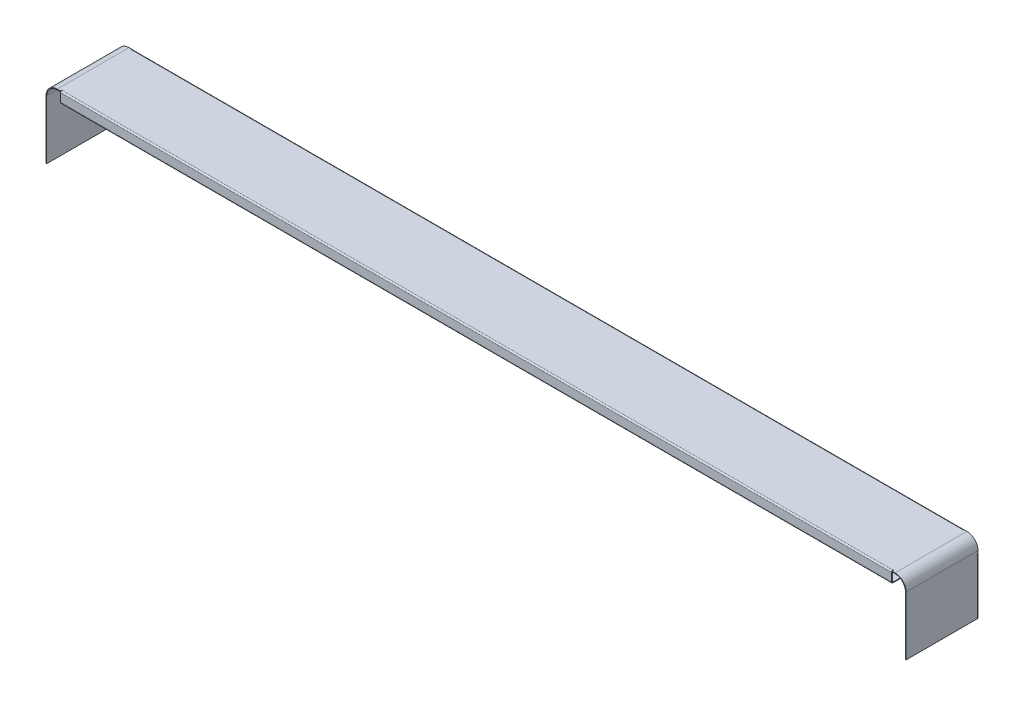
from build123d import *

# Parameters (mm, degrees)
BASE_FLANGE1_DEPTH             = 104
EDGE_FLANGE1_STRIP_W           = 6
EDGE_FLANGE1_STRIP_H           = 1
EDGE_FLANGE1_STRIP_CUT_DEPTH   = 1202
EDGE_FLANGE1_RELIEF_W          = 6.5
EDGE_FLANGE1_RELIEF_H          = 0.5
EDGE_FLANGE1_RELIEF_CUT_DEPTH  = 1
EDGE_FLANGE1_DEPTH             = 1202
EDGE_FLANGE2_STRIP_W           = 6
EDGE_FLANGE2_STRIP_H           = 1
EDGE_FLANGE2_STRIP_CUT_DEPTH   = 1202
EDGE_FLANGE2_DEPTH             = 1202
EDGE_FLANGE3_STRIP_W           = 6
EDGE_FLANGE3_STRIP_H           = 1
EDGE_FLANGE3_STRIP_CUT_DEPTH   = 80
EDGE_FLANGE3_RELIEF_W          = 6.5
EDGE_FLANGE3_RELIEF_H          = 0.5
EDGE_FLANGE3_RELIEF_CUT_DEPTH  = 1
EDGE_FLANGE3_DEPTH             = 80
EDGE_FLANGE4_STRIP_W           = 6
EDGE_FLANGE4_STRIP_H           = 1
EDGE_FLANGE4_STRIP_CUT_DEPTH   = 80
EDGE_FLANGE4_DEPTH             = 80
EDGE_FLANGE5_STRIP_W           = 6
EDGE_FLANGE5_STRIP_H           = 1
EDGE_FLANGE5_STRIP_CUT_DEPTH   = 1202
EDGE_FLANGE5_RELIEF_W          = 6.5
EDGE_FLANGE5_RELIEF_H          = 0.5
EDGE_FLANGE5_RELIEF_CUT_DEPTH  = 1
EDGE_FLANGE5_DEPTH             = 1202
SKETCH22_R                     = 3
CUT_EXTRUDE1_DEPTH             = 1
SKETCH23_R                     = 3
CUT_EXTRUDE2_DEPTH             = 3
CUT_EXTRUDE2_DIRECTION_2_REACH = 1234.474
EDGE_FLANGE6_STRIP_W           = 6
EDGE_FLANGE6_STRIP_H           = 1
EDGE_FLANGE6_STRIP_CUT_DEPTH   = 1202
EDGE_FLANGE6_DEPTH             = 1202


# Sheet-metal steps are written as plain solids
with BuildPart() as part:
    # Sketch1 → Base-Flange1 (new body)
    with BuildSketch(Plane.XY):
        with BuildLine():
            Line((-621, -100), (-621, -15))
            ThreePointArc((-621, -15), (-616.606601718, -4.393398282), (-606, 0))
            Line((-606, 0), (606, 0))
            ThreePointArc((606, 0), (616.606601718, -4.393398282), (621, -15))
            Line((621, -15), (621, -100))
            Line((621, -100), (622, -100))
            Line((622, -100), (622, -15))
            ThreePointArc((622, -15), (617.313708499, -3.686291501), (606, 1))
            Line((606, 1), (-606, 1))
            ThreePointArc((-606, 1), (-617.313708499, -3.686291501), (-622, -15))
            Line((-622, -15), (-622, -100))
            Line((-622, -100), (-621, -100))
        make_face()
    extrude(amount=BASE_FLANGE1_DEPTH)

    # Edge-Flange1 strip (across the edge) → Edge-Flange1 strip cut (cut)
    with BuildSketch(Plane(origin=(-601, 0, 0), x_dir=(0, 0, 1), z_dir=(1, 0, 0))):
        with Locations((-2, -0.5)):
            Rectangle(EDGE_FLANGE1_STRIP_W, EDGE_FLANGE1_STRIP_H)
    extrude(amount=EDGE_FLANGE1_STRIP_CUT_DEPTH, mode=Mode.SUBTRACT)

    # Edge-Flange1 relief (on the sheet) → Edge-Flange1 relief cut (cut)
    with BuildSketch(Plane(origin=(-601, 0, 1), x_dir=(0, 0, 1), z_dir=(0, -1, 0))):
        with Locations((-2.75, 0.25)):
            Rectangle(EDGE_FLANGE1_RELIEF_W, EDGE_FLANGE1_RELIEF_H)
        with Locations((-2.75, -1202.25)):
            Rectangle(EDGE_FLANGE1_RELIEF_W, EDGE_FLANGE1_RELIEF_H)
    extrude(amount=-EDGE_FLANGE1_RELIEF_CUT_DEPTH, mode=Mode.SUBTRACT)

    # Edge-Flange1 section (across the edge) → Edge-Flange1 (add)
    with BuildSketch(Plane(origin=(-601, 0, 0), x_dir=(0, 0, 1), z_dir=(1, 0, 0))):
        with BuildLine():
            Line((-1, 1), (-1, 19))
            Line((-1, 19), (0, 19))
            Line((0, 19), (0, 1))
            ThreePointArc((0, 1), (0.292893219, 0.292893219), (1, 0))
            Line((1, 0), (1, -1))
            ThreePointArc((1, -1), (-0.414213562, -0.414213562), (-1, 1))
        make_face()
    extrude(amount=EDGE_FLANGE1_DEPTH)

    # Edge-Flange2 strip (across the edge) → Edge-Flange2 strip cut (cut)
    with BuildSketch(Plane(origin=(-601, -19, 0), x_dir=(0, 1, 0), z_dir=(1, 0, 0))):
        with Locations((-1, -0.5)):
            Rectangle(EDGE_FLANGE2_STRIP_W, EDGE_FLANGE2_STRIP_H)
    extrude(amount=EDGE_FLANGE2_STRIP_CUT_DEPTH, mode=Mode.SUBTRACT)

    # Edge-Flange2 section (across the edge) → Edge-Flange2 (add)
    with BuildSketch(Plane(origin=(-601, -19, 0), x_dir=(0, 1, 0), z_dir=(1, 0, 0))):
        with BuildLine():
            Line((0, 1), (0, 18))
            Line((0, 18), (1, 18))
            Line((1, 18), (1, 1))
            ThreePointArc((1, 1), (1.292893219, 0.292893219), (2, 0))
            Line((2, 0), (2, -1))
            ThreePointArc((2, -1), (0.585786438, -0.414213562), (0, 1))
        make_face()
    extrude(amount=EDGE_FLANGE2_DEPTH)

    # Edge-Flange3 strip (across the edge) → Edge-Flange3 strip cut (cut)
    with BuildSketch(Plane(origin=(-621, -100, 0), x_dir=(0, 0, 1), z_dir=(0, 1, 0))):
        with Locations((-2, -0.5)):
            Rectangle(EDGE_FLANGE3_STRIP_W, EDGE_FLANGE3_STRIP_H)
    edge_flange3_strip_cut = extrude(amount=EDGE_FLANGE3_STRIP_CUT_DEPTH, mode=Mode.SUBTRACT)

    # Edge-Flange3 relief (on the sheet) → Edge-Flange3 relief cut (cut)
    with BuildSketch(Plane(origin=(-621, -100, 1), x_dir=(0, 0, 1), z_dir=(1, 0, 0))):
        with Locations((-2.75, -80.25)):
            Rectangle(EDGE_FLANGE3_RELIEF_W, EDGE_FLANGE3_RELIEF_H)
    edge_flange3_relief_cut = extrude(amount=-EDGE_FLANGE3_RELIEF_CUT_DEPTH, mode=Mode.SUBTRACT)

    # Edge-Flange3 section (across the edge) → Edge-Flange3 (add)
    with BuildSketch(Plane(origin=(-621, -100, 0), x_dir=(0, 0, 1), z_dir=(0, 1, 0))):
        with BuildLine():
            Line((-1, 1), (-1, 19))
            Line((-1, 19), (0, 19))
            Line((0, 19), (0, 1))
            ThreePointArc((0, 1), (0.292893219, 0.292893219), (1, 0))
            Line((1, 0), (1, -1))
            ThreePointArc((1, -1), (-0.414213562, -0.414213562), (-1, 1))
        make_face()
    edge_flange3 = extrude(amount=EDGE_FLANGE3_DEPTH)

    # Edge-Flange4 strip (across the edge) → Edge-Flange4 strip cut (cut)
    with BuildSketch(Plane(origin=(-602, -100, 0), x_dir=(-1, 0, 0), z_dir=(0, 1, 0))):
        with Locations((-1, -0.5)):
            Rectangle(EDGE_FLANGE4_STRIP_W, EDGE_FLANGE4_STRIP_H)
    edge_flange4_strip_cut = extrude(amount=EDGE_FLANGE4_STRIP_CUT_DEPTH, mode=Mode.SUBTRACT)

    # Edge-Flange4 section (across the edge) → Edge-Flange4 (add)
    with BuildSketch(Plane(origin=(-602, -100, 0), x_dir=(-1, 0, 0), z_dir=(0, 1, 0))):
        with BuildLine():
            Line((0, 1), (0, 18))
            Line((0, 18), (1, 18))
            Line((1, 18), (1, 1))
            ThreePointArc((1, 1), (1.292893219, 0.292893219), (2, 0))
            Line((2, 0), (2, -1))
            ThreePointArc((2, -1), (0.585786438, -0.414213562), (0, 1))
        make_face()
    edge_flange4 = extrude(amount=EDGE_FLANGE4_DEPTH)

    # Mirror1: Edge-Flange3 strip cut, Edge-Flange3 relief cut, Edge-Flange3, Edge-Flange4 strip cut, Edge-Flange4 across plane
    add(edge_flange3_strip_cut.mirror(Plane(origin=(0, 0, 0), x_dir=(0, 0, 1), z_dir=(1, 0, 0))), mode=Mode.SUBTRACT)
    add(edge_flange3_relief_cut.mirror(Plane(origin=(0, 0, 0), x_dir=(0, 0, 1), z_dir=(1, 0, 0))), mode=Mode.SUBTRACT)
    add(edge_flange3.mirror(Plane(origin=(0, 0, 0), x_dir=(0, 0, 1), z_dir=(1, 0, 0))))
    add(edge_flange4_strip_cut.mirror(Plane(origin=(0, 0, 0), x_dir=(0, 0, 1), z_dir=(1, 0, 0))), mode=Mode.SUBTRACT)
    add(edge_flange4.mirror(Plane(origin=(0, 0, 0), x_dir=(0, 0, 1), z_dir=(1, 0, 0))))

    # Edge-Flange5 strip (across the edge) → Edge-Flange5 strip cut (cut)
    with BuildSketch(Plane(origin=(601, 0, 104), x_dir=(0, 0, -1), z_dir=(-1, 0, 0))):
        with Locations((-1, -0.5)):
            Rectangle(EDGE_FLANGE5_STRIP_W, EDGE_FLANGE5_STRIP_H)
    extrude(amount=EDGE_FLANGE5_STRIP_CUT_DEPTH, mode=Mode.SUBTRACT)

    # Edge-Flange5 relief (on the sheet) → Edge-Flange5 relief cut (cut)
    with BuildSketch(Plane(origin=(601, 0, 102), x_dir=(0, 0, -1), z_dir=(0, -1, 0))):
        with Locations((-2.75, 0.25)):
            Rectangle(EDGE_FLANGE5_RELIEF_W, EDGE_FLANGE5_RELIEF_H)
        with Locations((-2.75, -1202.25)):
            Rectangle(EDGE_FLANGE5_RELIEF_W, EDGE_FLANGE5_RELIEF_H)
    extrude(amount=-EDGE_FLANGE5_RELIEF_CUT_DEPTH, mode=Mode.SUBTRACT)

    # Edge-Flange5 section (across the edge) → Edge-Flange5 (add)
    with BuildSketch(Plane(origin=(601, 0, 104), x_dir=(0, 0, -1), z_dir=(-1, 0, 0))):
        with BuildLine():
            Line((0, 1), (0, 15))
            Line((0, 15), (1, 15))
            Line((1, 15), (1, 1))
            ThreePointArc((1, 1), (1.292893219, 0.292893219), (2, 0))
            Line((2, 0), (2, -1))
            ThreePointArc((2, -1), (0.585786438, -0.414213562), (0, 1))
        make_face()
    extrude(amount=EDGE_FLANGE5_DEPTH)

    # Sketch22 → Cut-Extrude1 (cut)
    with BuildSketch(Plane.XZ.offset(19)):
        with Locations(Location((-540, 12, 0), (0, 0, 270))):
            Circle(SKETCH22_R)
        with Locations(Location((-360, 12, 0), (0, 0, 270))):
            Circle(SKETCH22_R)
        with Locations(Location((-180, 12, 0), (0, 0, 270))):
            Circle(SKETCH22_R)
        with Locations(Location((0, 12, 0), (0, 0, 270))):
            Circle(SKETCH22_R)
        with Locations(Location((180, 12, 0), (0, 0, 270))):
            Circle(SKETCH22_R)
        with Locations(Location((360, 12, 0), (0, 0, 270))):
            Circle(SKETCH22_R)
        with Locations(Location((540, 12, 0), (0, 0, 270))):
            Circle(SKETCH22_R)
    extrude(amount=-CUT_EXTRUDE1_DEPTH, mode=Mode.SUBTRACT)

    # Sketch23 → Cut-Extrude2 (cut)
    with BuildSketch(Plane.ZY.offset(-602)):
        with Locations(Location((12, -68, 0), (0, 0, 180))):
            Circle(SKETCH23_R)
    extrude(amount=-CUT_EXTRUDE2_DEPTH, mode=Mode.SUBTRACT)

    # Cut-Extrude2 direction 2: up to this face of the body (flat: up to its plane)
    cut_extrude2_direction_2_end = Plane(part.part.faces().sort_by_distance((-603, -60, 9.5))[0])
    # Sketch23 → Cut-Extrude2 direction 2 (cut, up to the picked face)
    with BuildSketch(Plane.ZY.offset(-602), mode=Mode.PRIVATE) as cut_extrude2_direction_2_sk1:
        with Locations(Location((12, -68, 0), (0, 0, 180))):
            Circle(SKETCH23_R)
    cut_extrude2_direction_2_tool1 = split(extrude(cut_extrude2_direction_2_sk1.sketch, amount=CUT_EXTRUDE2_DIRECTION_2_REACH, mode=Mode.PRIVATE), bisect_by=cut_extrude2_direction_2_end, keep=Keep.BOTH, mode=Mode.PRIVATE)
    add(cut_extrude2_direction_2_tool1.solids().sort_by(Axis((602, -68, 12), (-1, 0, 0)))[0], mode=Mode.SUBTRACT)

    # Edge-Flange6 strip (across the edge) → Edge-Flange6 strip cut (cut)
    with BuildSketch(Plane(origin=(601, -15, 103), x_dir=(0, 1, 0), z_dir=(-1, 0, 0))):
        with Locations((-1, -0.5)):
            Rectangle(EDGE_FLANGE6_STRIP_W, EDGE_FLANGE6_STRIP_H)
    extrude(amount=EDGE_FLANGE6_STRIP_CUT_DEPTH, mode=Mode.SUBTRACT)

    # Edge-Flange6 section (across the edge) → Edge-Flange6 (add)
    with BuildSketch(Plane(origin=(601, -15, 103), x_dir=(0, 1, 0), z_dir=(-1, 0, 0))):
        with BuildLine():
            Line((0, 1), (0, 17))
            Line((0, 17), (1, 17))
            Line((1, 17), (1, 1))
            ThreePointArc((1, 1), (1.292893219, 0.292893219), (2, 0))
            Line((2, 0), (2, -1))
            ThreePointArc((2, -1), (0.585786438, -0.414213562), (0, 1))
        make_face()
    extrude(amount=EDGE_FLANGE6_DEPTH)


solid = part.part
